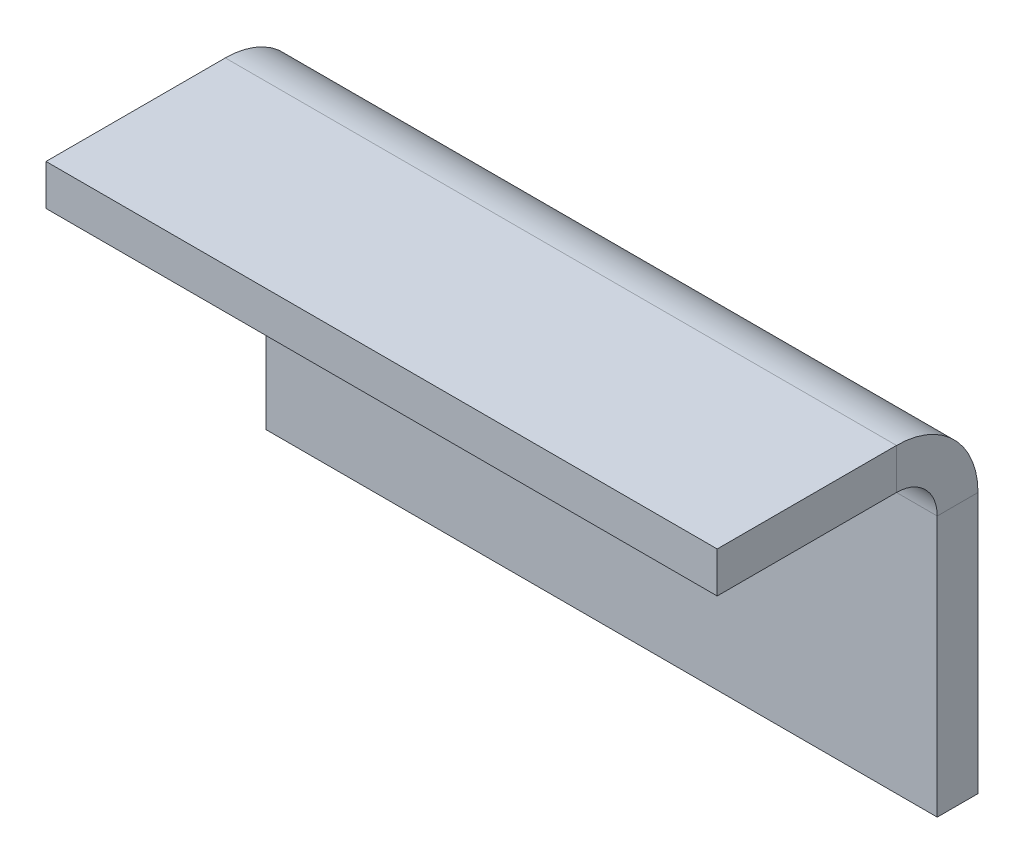
from build123d import *

# Parameters (mm, degrees)
SKETCH2_W          = 52.291467072
SKETCH2_H          = 20.32
BASE_FLANGE1_DEPTH = 3.175
EDGE_FLANGE1_DEPTH = 52.291467072


# Sheet-metal steps are written as plain solids
with BuildPart() as part:
    # Sketch2 → Base-Flange1 (new body)
    with BuildSketch(Plane.XY):
        with Locations((26.145733536, 10.16)):
            Rectangle(SKETCH2_W, SKETCH2_H)
    extrude(amount=-BASE_FLANGE1_DEPTH)

    # Edge-Flange1 section (across the edge) → Edge-Flange1 (add)
    with BuildSketch(Plane(origin=(52.291467072, 23.495, 0), x_dir=(0, -1, 0), z_dir=(-1, 0, 0))):
        with BuildLine():
            Line((-3.175, 3.175), (-3.175, 17.145))
            Line((-3.175, 17.145), (0, 17.145))
            Line((0, 17.145), (0, 3.175))
            ThreePointArc((0, 3.175), (0.92993597, 0.92993597), (3.175, 0))
            Line((3.175, 0), (3.175, -3.175))
            ThreePointArc((3.175, -3.175), (-1.315128061, -1.315128061), (-3.175, 3.175))
        make_face()
    extrude(amount=EDGE_FLANGE1_DEPTH)


solid = part.part
